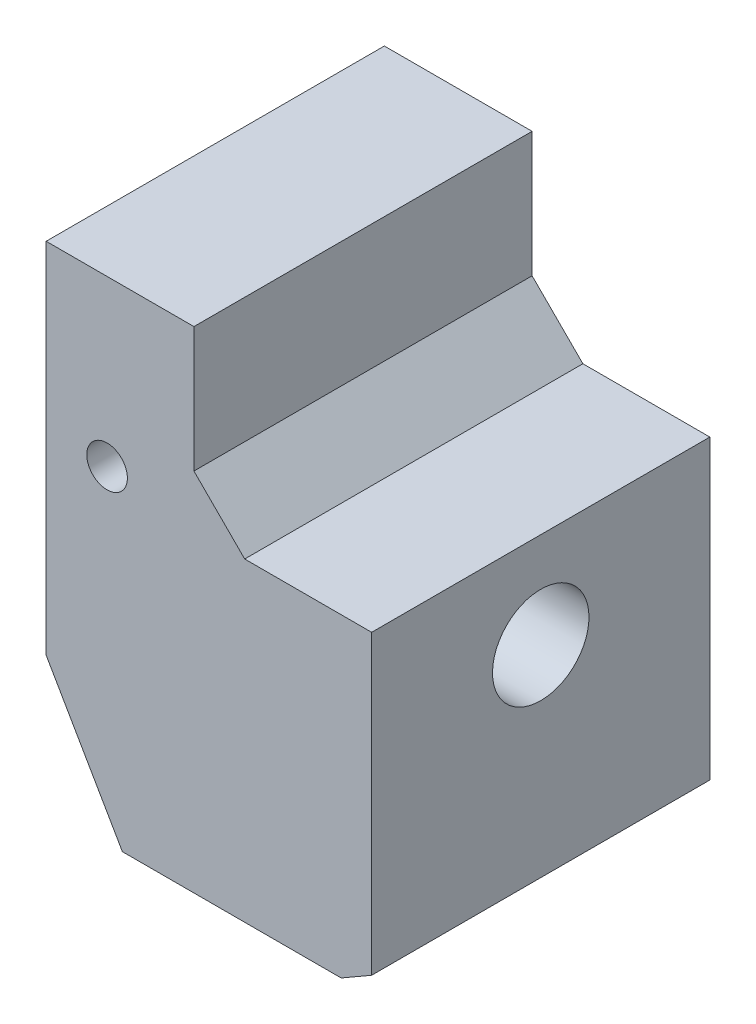
from build123d import *

# Parameters (mm, degrees)
SKETCH1_W               = 33.3
SKETCH1_H               = 48.3
BOSS_EXTRUDE1_DEPTH     = 9.55
CUT_EXTRUDE1_DEPTH      = 5.5
SKETCH3_W               = 5.65
SKETCH3_H               = 13.7
CUT_EXTRUDE2_DEPTH      = 5
SKETCH5_W               = 33.3
SKETCH5_H               = 48.3
BOSS_EXTRUDE3_DEPTH     = 22.5
SKETCH6_R               = 4.025
CUT_EXTRUDE3_DEPTH      = 12
SKETCH7_R               = 4.75
CUT_EXTRUDE4_DEPTH      = 14.55
CUT_EXTRUDE6_DEPTH      = 46.909857329
CUT_EXTRUDE6_DEPTH_BACK = 46.909857329
SKETCH27_R              = 2
SKETCH30_R              = 4
SKETCH31_R              = 5
CHAMFER1_SIZE           = 13
CHAMFER1_SIZE2          = 7.505553499
CHAMFER2_SIZE           = 10
CHAMFER2_SIZE2          = 17.320508076
CHAMFER3_SIZE           = 1.732050808
CHAMFER3_SIZE_2         = 3
CROQUIS2_W              = 17.5
CROQUIS2_H              = 17.320508076
CORTAR_EXTRUIR1_DEPTH   = 48
CHAMFER4_SIZE           = 5


with BuildPart() as part:
    # Sketch1 → Boss-Extrude1 (new body)
    with BuildSketch(Plane(origin=(0, 0, 0), x_dir=(0, 0, -1), z_dir=(1, 0, 0))):
        Rectangle(SKETCH1_W, SKETCH1_H)
    extrude(amount=BOSS_EXTRUDE1_DEPTH)

    # Sketch2 → Cut-Extrude1 (cut)
    # profile 1 of 2: a face of its own
    with BuildSketch(Plane.ZY):
        Polygon((-5.5, 13.039115125), (-5.5, 20.15), (4.5, 20.15), (6.65, 20.15), (6.65, 5.993768204), (12.65, -0.443622572), (12.65, -9.1), (12.65, -10.95), (-12.65, -10.95), (-12.65, -9.1), (-12.65, -0.443622572), (-6.65, 5.993768204), (-6.65, 11.855899168), align=None)
        Polygon((4.5, 19.15), (5.65, 19.15), (5.65, 5.6), (11.65, -0.837390776), (11.65, -9.1), (11.65, -9.95), (-11.65, -9.95), (-11.65, -9.1), (-11.65, -0.837390776), (-5.65, 5.6), (-5.65, 11.45), (-4.5, 12.633215957), (-4.5, 19.15), align=None, mode=Mode.SUBTRACT)
    # profile 2 of 2: a face of its own
    with BuildSketch(Plane.ZY):
        Polygon((5.65, 19.15), (5.65, 5.6), (11.65, -0.837390776), (11.65, -9.1), (11.65, -9.95), (-11.65, -9.95), (-11.65, -9.1), (-11.65, -0.837390776), (-5.65, 5.6), (-5.65, 11.45), (-4.5, 12.633215957), (-4.5, 19.15), (4.5, 19.15), align=None)
    extrude(amount=-CUT_EXTRUDE1_DEPTH, mode=Mode.SUBTRACT)

    # Sketch3 → Cut-Extrude2 (cut)
    # profile 1 of 3: a face of its own
    with BuildSketch(Plane.ZY.offset(-5.5)):
        Polygon((-6.65, 4.45), (6.65, 4.45), (6.65, 20.15), (-5.5, 20.15), (-5.5, 13.039115125), (-6.65, 11.855899168), align=None)
        Polygon((5.65, 5.45), (5.65, 19.15), (-4.5, 19.15), (-4.5, 12.633215957), (-5.65, 11.45), (-5.65, 5.45), align=None, mode=Mode.SUBTRACT)
    # profile 2 of 3: a face of its own
    with BuildSketch(Plane.ZY.offset(-5.5)):
        Polygon((0, 5.45), (0, 19.15), (-4.5, 19.15), (-4.5, 12.633215957), (-5.65, 11.45), (-5.65, 5.45), align=None)
    # profile 3 of 3: a face of its own
    with BuildSketch(Plane.ZY.offset(-5.5)):
        with Locations((2.825, 12.3)):
            Rectangle(SKETCH3_W, SKETCH3_H)
    extrude(amount=-CUT_EXTRUDE2_DEPTH, mode=Mode.SUBTRACT)

    # Sketch5 → Boss-Extrude3 (add)
    with BuildSketch(Plane(origin=(9.55, 0, 0), x_dir=(0, 0, -1), z_dir=(1, 0, 0))):
        Rectangle(SKETCH5_W, SKETCH5_H)
    extrude(amount=BOSS_EXTRUDE3_DEPTH)

    # Sketch6 → Cut-Extrude3 (cut)
    with BuildSketch(Plane.ZY.offset(-5.5)):
        with Locations((0, -2.575)):
            Circle(SKETCH6_R)
    extrude(amount=-CUT_EXTRUDE3_DEPTH, mode=Mode.SUBTRACT)

    # Sketch7 → Cut-Extrude4 (cut)
    with BuildSketch(Plane.ZY.offset(-17.5)):
        with Locations((0, -2.575)):
            Circle(SKETCH7_R)
    extrude(amount=-CUT_EXTRUDE4_DEPTH, mode=Mode.SUBTRACT)

    # Sketch27 → Cut-Extrude6 (cut, two sides: drawn at the far end of the back side and taken through both)
    with BuildSketch(Plane(origin=(0, 0, 5.65), x_dir=(-1, 0, 0), z_dir=(0, 0, -1)).offset(-CUT_EXTRUDE6_DEPTH_BACK)):
        with Locations((-6, 7.95)):
            Circle(SKETCH27_R)
    extrude(amount=CUT_EXTRUDE6_DEPTH + CUT_EXTRUDE6_DEPTH_BACK, mode=Mode.SUBTRACT)

    # Cut-Sweep1: sweep along a path in Sketch28
    with BuildLine(Plane.XY) as cut_sweep1_path:
        Line((25.736872918, -27.79488562), (13.5, -6.6))
        Line((13.5, -6.6), (11.25, -2.702885683))
    # Sketch30 → Cut-Sweep1 (sweep, cut)
    with BuildSketch(Plane(origin=(18.469756751, -31.990557096, 0), x_dir=(0, 0, -1), z_dir=(0.500000000000001, -0.866025403784438, 0))):
        with Locations((0, 8.391342951)):
            Circle(SKETCH30_R)
    sweep(path=cut_sweep1_path.line, mode=Mode.SUBTRACT)

    # Cut-Sweep2: sweep along a path in Sketch29
    with BuildLine(Plane.XY) as cut_sweep2_path:
        Line((19.5, -16.992304845), (25.736872918, -27.79488562))
    # Sketch31 → Cut-Sweep2 (sweep, cut)
    with BuildSketch(Plane(origin=(18.469756751, -31.990557096, 0), x_dir=(0, 0, -1), z_dir=(0.500000000000001, -0.866025403784438, 0))):
        with Locations((0, 8.391342951)):
            Circle(SKETCH31_R)
    sweep(path=cut_sweep2_path.line, mode=Mode.SUBTRACT)

    # Chamfer1
    chamfer1_edges = [part.edges().sort_by_distance(p)[0] for p in [
        (0, -24.15, 0),
    ]]
    chamfer1_side = [part.faces().sort_by_distance(p)[0] for p in [
        (0, 23.563333144, 0),
    ]]
    chamfer(chamfer1_edges, length=CHAMFER1_SIZE, length2=CHAMFER1_SIZE2, reference=chamfer1_side[0])

    # Chamfer2
    chamfer2_edges = [part.edges().sort_by_distance(p)[0] for p in [
        (32.05, 24.15, 0),
    ]]
    chamfer2_side = [part.faces().sort_by_distance(p)[0] for p in [
        (16.025, 24.15, 0),
    ]]
    chamfer(chamfer2_edges, length=CHAMFER2_SIZE, length2=CHAMFER2_SIZE2, reference=chamfer2_side[0])

    # Chamfer3
    # the kernel refuses this chamfer: 3, 1.732050808 mm, written as the material it takes off along each edge
    with BuildSketch(Plane(origin=(32.05, -24.15, -24.411257264), x_dir=(0.05789386240267215, 0.9983227437537925, 0), z_dir=(0, 0, 1))) as chamfer3_piece_1:
        Polygon((CHAMFER3_SIZE * 0.998322743505, CHAMFER3_SIZE * 0.0578938623883), (-CHAMFER3_SIZE_2 * 0.0578938624027, CHAMFER3_SIZE_2 * 0.998322743754), (0, 0), align=None)
    extrude(amount=48.822514528, mode=Mode.SUBTRACT)

    # Croquis2 → Cortar-Extruir1 (cut)
    with BuildSketch(Plane.XY.offset(16.65)):
        with Locations((23.3, 15.489745962)):
            Rectangle(CROQUIS2_W, CROQUIS2_H)
    extrude(amount=-CORTAR_EXTRUIR1_DEPTH, mode=Mode.SUBTRACT)

    # Chamfer4
    chamfer4_edges = [part.edges().sort_by_distance(p)[0] for p in [
        (14.55, 6.829491924, 0),
    ]]
    chamfer(chamfer4_edges, length=CHAMFER4_SIZE)

    # Sketch33 → Cut-Loft2 section 0
    with BuildSketch(Plane.ZY):
        with BuildLine():
            Line((0, -9.95), (0, -15.45))
            Line((0, -15.45), (2.5, -15.45))
            Line((2.5, -15.45), (2.5, -9.95))
            Line((2.5, -9.95), (0, -9.95))
        make_face()
    # Sketch34 → Cut-Loft2 section 1
    with BuildSketch(Plane.ZY.offset(-5.5)):
        with BuildLine():
            Line((0, -9.95), (2.5, -9.95))
            Line((2.5, -9.95), (2.5, -10.45))
            Line((2.5, -10.45), (0, -10.45))
            Line((0, -10.45), (0, -9.95))
        make_face()
    loft(mode=Mode.SUBTRACT)


solid = part.part
